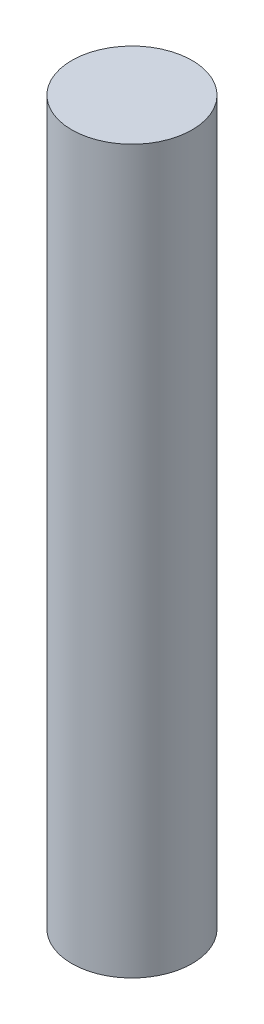
from build123d import *

# Parameters (mm, degrees)
SKETCH1_R           = 25
BOSS_EXTRUDE1_DEPTH = 300


with BuildPart() as part:
    # Sketch1 → Boss-Extrude1 (new body)
    with BuildSketch(Plane(origin=(0, 0, 0), x_dir=(1, 0, 0), z_dir=(0, 1, 0))):
        Circle(SKETCH1_R)
    extrude(amount=BOSS_EXTRUDE1_DEPTH)


solid = part.part
